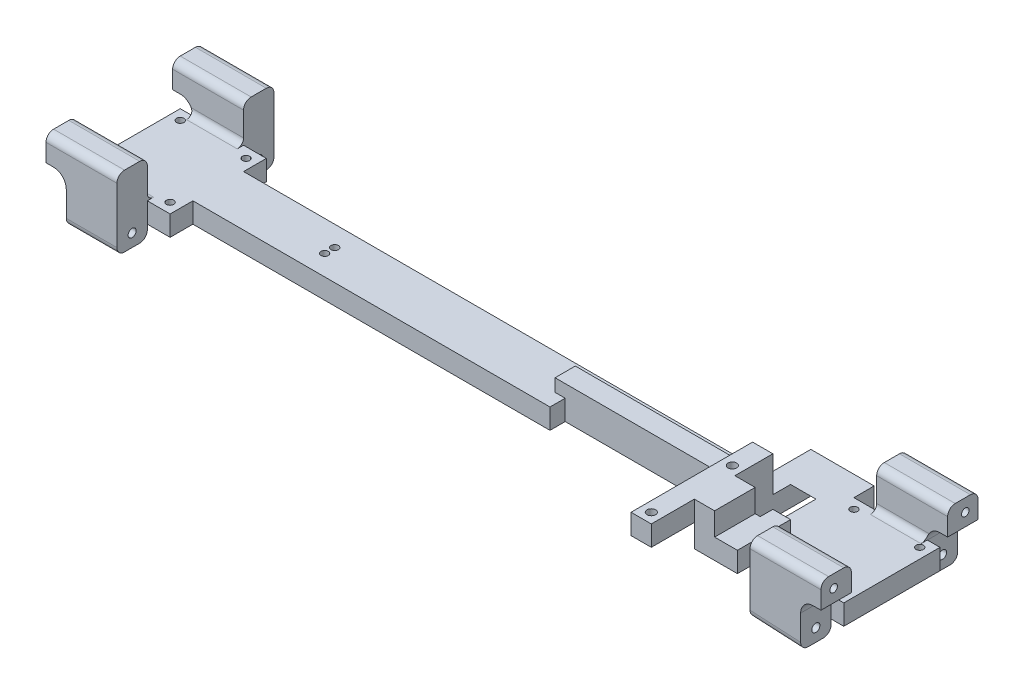
from build123d import *

# Parameters (mm, degrees)
SKETCH1_W                 = 300
SKETCH1_H                 = 20
BOSS_EXTRUDE1_DEPTH       = 8
SKETCH2_W                 = 34
SKETCH2_H                 = 8
BOSS_EXTRUDE2_DEPTH       = 9
SKETCH3_W                 = 34
SKETCH3_H                 = 8
BOSS_EXTRUDE3_DEPTH       = 9
SKETCH4_R                 = 1.45
CUT_EXTRUDE1_DEPTH        = 302.504560496
SKETCH5_W                 = 25
SKETCH5_H                 = 8
BOSS_EXTRUDE4_DEPTH       = 17
SKETCH6_W                 = 25
SKETCH6_H                 = 8
BOSS_EXTRUDE5_DEPTH       = 17
SKETCH12_W                = 8
SKETCH12_H                = 8
BOSS_EXTRUDE7_DEPTH       = 17
BOSS_EXTRUDE8_DEPTH       = 12
SKETCH15_R                = 1.6
CUT_EXTRUDE7_DEPTH        = 20
SKETCH16_W                = 20
SKETCH16_H                = 13
BOSS_EXTRUDE9_DEPTH       = 12
SKETCH17_R                = 1.6
CUT_EXTRUDE8_DEPTH        = 20
SKETCH18_W                = 20
SKETCH18_H                = 13
BOSS_EXTRUDE10_DEPTH      = 12
CUT_EXTRUDE9_START        = -20
SKETCH19_R                = 1.6
CUT_EXTRUDE9_DEPTH        = 20
SKETCH20_W                = 20
SKETCH20_H                = 13
BOSS_EXTRUDE11_DEPTH      = 12
CUT_EXTRUDE10_START       = -20
SKETCH21_R                = 1.6
CUT_EXTRUDE10_DEPTH       = 20
SKETCH22_W                = 10
SKETCH22_H                = 38
CUT_EXTRUDE11_DEPTH       = 306.0983448
SKETCH23_W                = 8
SKETCH23_H                = 18
CUT_EXTRUDE12_DEPTH       = 4
BOSS_EXTRUDE12_DEPTH      = 10
BOSS_EXTRUDE13_DEPTH      = 8
SKETCH26_W                = 8
SKETCH26_H                = 48
BOSS_EXTRUDE14_DEPTH      = 14
SKETCH27_W                = 8
SKETCH27_H                = 16
BOSS_EXTRUDE15_DEPTH      = 14
SKETCH28_W                = 8
SKETCH28_H                = 40
CUT_EXTRUDE13_DEPTH       = 14
SKETCH30_W                = 16
SKETCH30_H                = 14
BOSS_EXTRUDE16_DEPTH      = 9
SKETCH31_W                = 17
SKETCH31_H                = 8
CUT_EXTRUDE14_DEPTH       = 5
SKETCH32_W                = 16
SKETCH32_H                = 9
CUT_EXTRUDE15_DEPTH       = 9
CUT_EXTRUDE16_DEPTH       = 10
SKETCH34_W                = 7
SKETCH34_H                = 5
CUT_EXTRUDE17_DEPTH       = 5
SKETCH35_W                = 7
SKETCH35_H                = 5
BOSS_EXTRUDE17_DEPTH      = 5
SKETCH36_R                = 1.7
CUT_EXTRUDE18_DEPTH       = 307.014705529
SKETCH37_W                = 70
SKETCH37_H                = 8
BOSS_EXTRUDE18_DEPTH      = 5
SKETCH39_W                = 66
SKETCH39_H                = 6
CUT_EXTRUDE19_DEPTH       = 306.14258962
SKETCH40_W                = 20
SKETCH40_H                = 12
BOSS_EXTRUDE19_DEPTH      = 10
BOSS_EXTRUDE20_DEPTH      = 5
BOSS_EXTRUDE20_DEPTH_BACK = 5
SKETCH41_W                = 28
SKETCH41_H                = 12
SKETCH42_R                = 1.5
CUT_EXTRUDE20_DEPTH       = 15
SKETCH43_W                = 20
SKETCH43_H                = 12
BOSS_EXTRUDE21_DEPTH      = 10
BOSS_EXTRUDE22_DEPTH      = 5
BOSS_EXTRUDE22_DEPTH_BACK = 5
SKETCH44_W                = 28
SKETCH44_H                = 12
SKETCH45_R                = 1.5
CUT_EXTRUDE21_DEPTH       = 15
SKETCH46_W                = 20
SKETCH46_H                = 12
SKETCH46_W_2              = 19.974984355
BOSS_EXTRUDE23_DEPTH      = 10
BOSS_EXTRUDE24_DEPTH      = 5
BOSS_EXTRUDE24_DEPTH_BACK = 5
SKETCH47_W                = 28
SKETCH47_H                = 12
SKETCH47_W_2              = 28.025015645
CUT_EXTRUDE22_START       = -15
SKETCH48_R                = 1.5
CUT_EXTRUDE22_DEPTH       = 15
FILLET1_R                 = 5
FILLET2_R                 = 2.5
FILLET3_R                 = 3
FILLET4_R                 = 3
SKETCH49_R                = 1.45
CUT_EXTRUDE23_DEPTH       = 309.139578763


with BuildPart() as part:
    # Sketch1 → Boss-Extrude1 (new body)
    with BuildSketch(Plane(origin=(0, 0, 0), x_dir=(1, 0, 0), z_dir=(0, 1, 0))):
        with Locations((150, -10)):
            Rectangle(SKETCH1_W, SKETCH1_H)
    extrude(amount=BOSS_EXTRUDE1_DEPTH)

    # Sketch2 → Boss-Extrude2 (add)
    with BuildSketch(Plane.XY.offset(20)):
        with Locations((17, 4)):
            Rectangle(SKETCH2_W, SKETCH2_H)
        with Locations((283, 4)):
            Rectangle(SKETCH2_W, SKETCH2_H)
    extrude(amount=BOSS_EXTRUDE2_DEPTH)

    # Sketch3 → Boss-Extrude3 (add)
    with BuildSketch(Plane(origin=(0, 0, 0), x_dir=(-1, 0, 0), z_dir=(0, 0, -1))):
        with Locations((-17, 4)):
            Rectangle(SKETCH3_W, SKETCH3_H)
        with Locations((-283, 4)):
            Rectangle(SKETCH3_W, SKETCH3_H)
    extrude(amount=BOSS_EXTRUDE3_DEPTH)

    # Sketch4 → Cut-Extrude1 (cut, through all)
    with BuildSketch(Plane(origin=(0, 8, 0), x_dir=(1, 0, 0), z_dir=(0, 1, 0))):
        with Locations(Location((4, 5, 0), (0, 0, 270))):
            Circle(SKETCH4_R)
        with Locations(Location((30, 5, 0), (0, 0, 270))):
            Circle(SKETCH4_R)
        with Locations(Location((30, -25, 0), (0, 0, 270))):
            Circle(SKETCH4_R)
        with Locations(Location((4, -25, 0), (0, 0, 270))):
            Circle(SKETCH4_R)
        with Locations(Location((296, -25, 0), (0, 0, 270))):
            Circle(SKETCH4_R)
        with Locations(Location((296, 5, 0), (0, 0, 270))):
            Circle(SKETCH4_R)
        with Locations(Location((270, -25, 0), (0, 0, 270))):
            Circle(SKETCH4_R)
        with Locations(Location((270, 5, 0), (0, 0, 270))):
            Circle(SKETCH4_R)
    extrude(amount=-CUT_EXTRUDE1_DEPTH, mode=Mode.SUBTRACT)

    # Sketch5 → Boss-Extrude4 (add)
    with BuildSketch(Plane.XY.offset(20)):
        with Locations((253.5, 4)):
            Rectangle(SKETCH5_W, SKETCH5_H)
    extrude(amount=BOSS_EXTRUDE4_DEPTH)

    # Sketch6 → Boss-Extrude5 (add)
    with BuildSketch(Plane(origin=(0, 0, 0), x_dir=(-1, 0, 0), z_dir=(0, 0, -1))):
        with Locations((-253.5, 4)):
            Rectangle(SKETCH6_W, SKETCH6_H)
    extrude(amount=BOSS_EXTRUDE5_DEPTH)

    # Sketch12 → Boss-Extrude7 (add)
    with BuildSketch(Plane.XY.offset(37)):
        with Locations((245, 4)):
            Rectangle(SKETCH12_W, SKETCH12_H)
    extrude(amount=BOSS_EXTRUDE7_DEPTH)

    # Sketch14 → Boss-Extrude8 (add)
    with BuildSketch(Plane.XY.offset(29)):
        Polygon((294.974984355, 8), (275, 8), (275, -4), (294.974984355, -5), align=None)
    extrude(amount=BOSS_EXTRUDE8_DEPTH)

    # Sketch15 → Cut-Extrude7 (cut)
    with BuildSketch(Plane(origin=(294.974984355, 0, 0), x_dir=(0, 0, -1), z_dir=(1, 0, 0))):
        with Locations((-35, 0)):
            Circle(SKETCH15_R)
    extrude(amount=-CUT_EXTRUDE7_DEPTH, mode=Mode.SUBTRACT)

    # Sketch16 → Boss-Extrude9 (add)
    with BuildSketch(Plane(origin=(0, 0, -9), x_dir=(-1, 0, 0), z_dir=(0, 0, -1))):
        with Locations((-285, 1.5)):
            Rectangle(SKETCH16_W, SKETCH16_H)
    extrude(amount=BOSS_EXTRUDE9_DEPTH)

    # Sketch17 → Cut-Extrude8 (cut)
    with BuildSketch(Plane(origin=(295, 0, 0), x_dir=(0, 0, -1), z_dir=(1, 0, 0))):
        with Locations((15, 0)):
            Circle(SKETCH17_R)
    extrude(amount=-CUT_EXTRUDE8_DEPTH, mode=Mode.SUBTRACT)

    # Sketch18 → Boss-Extrude10 (add)
    with BuildSketch(Plane(origin=(0, 0, -9), x_dir=(-1, 0, 0), z_dir=(0, 0, -1))):
        with Locations((-15, 1.5)):
            Rectangle(SKETCH18_W, SKETCH18_H)
    extrude(amount=BOSS_EXTRUDE10_DEPTH)

    # Sketch19 → Cut-Extrude9 (cut)
    with BuildSketch(Plane.ZY.offset(-5).offset(CUT_EXTRUDE9_START)):
        with Locations(Location((-15, 0, 0), (0, 0, 180))):
            Circle(SKETCH19_R)
    extrude(amount=CUT_EXTRUDE9_DEPTH, mode=Mode.SUBTRACT)

    # Sketch20 → Boss-Extrude11 (add)
    with BuildSketch(Plane.XY.offset(29)):
        with Locations((15, 1.5)):
            Rectangle(SKETCH20_W, SKETCH20_H)
    extrude(amount=BOSS_EXTRUDE11_DEPTH)

    # Sketch21 → Cut-Extrude10 (cut)
    with BuildSketch(Plane.ZY.offset(-5).offset(CUT_EXTRUDE10_START)):
        with Locations(Location((35, 0, 0), (0, 0, 180))):
            Circle(SKETCH21_R)
    extrude(amount=CUT_EXTRUDE10_DEPTH, mode=Mode.SUBTRACT)

    # Sketch22 → Cut-Extrude11 (cut, through all)
    with BuildSketch(Plane(origin=(0, 8, 0), x_dir=(1, 0, 0), z_dir=(0, 1, 0))):
        with Locations((254, -10)):
            Rectangle(SKETCH22_W, SKETCH22_H)
    extrude(amount=-CUT_EXTRUDE11_DEPTH, mode=Mode.SUBTRACT)

    # Sketch23 → Cut-Extrude12 (cut)
    with BuildSketch(Plane(origin=(0, 0, 0), x_dir=(-1, 0, 0), z_dir=(0, -1, 0))):
        with Locations((-263, -10)):
            Rectangle(SKETCH23_W, SKETCH23_H)
    extrude(amount=-CUT_EXTRUDE12_DEPTH, mode=Mode.SUBTRACT)

    # Sketch24 → Boss-Extrude12 (add)
    with BuildSketch(Plane.ZY.offset(-259)):
        Polygon((-9, 0), (-9, 8), (-1, 8), align=None)
        Polygon((29, 0), (29, 8), (21, 8), align=None)
    extrude(amount=BOSS_EXTRUDE12_DEPTH)

    # Sketch25 → Boss-Extrude13 (add)
    with BuildSketch(Plane.ZY.offset(-267)):
        Polygon((19, 0), (19, 4), (15, 4), align=None)
        Polygon((1, 4), (5, 4), (1, 0), align=None)
    extrude(amount=BOSS_EXTRUDE13_DEPTH)

    # Sketch26 → Boss-Extrude14 (add)
    with BuildSketch(Plane(origin=(0, 8, 0), x_dir=(1, 0, 0), z_dir=(0, 1, 0))):
        with Locations((245, -30)):
            Rectangle(SKETCH26_W, SKETCH26_H)
    extrude(amount=BOSS_EXTRUDE14_DEPTH)

    # Sketch27 → Boss-Extrude15 (add)
    with BuildSketch(Plane(origin=(0, 8, 0), x_dir=(1, 0, 0), z_dir=(0, 1, 0))):
        with Locations((253, -29)):
            Rectangle(SKETCH27_W, SKETCH27_H)
    extrude(amount=BOSS_EXTRUDE15_DEPTH)

    # Sketch28 → Cut-Extrude13 (cut)
    with BuildSketch(Plane.XZ):
        with Locations((245, 34)):
            Rectangle(SKETCH28_W, SKETCH28_H)
    extrude(amount=-CUT_EXTRUDE13_DEPTH, mode=Mode.SUBTRACT)

    # Sketch30 → Boss-Extrude16 (add)
    with BuildSketch(Plane(origin=(257, 0, 0), x_dir=(0, 0, -1), z_dir=(1, 0, 0))):
        with Locations((-29, 15)):
            Rectangle(SKETCH30_W, SKETCH30_H)
    extrude(amount=BOSS_EXTRUDE16_DEPTH)

    # Sketch31 → Cut-Extrude14 (cut)
    with BuildSketch(Plane(origin=(0, 0, 0), x_dir=(-1, 0, 0), z_dir=(0, -1, 0))):
        with Locations((-257.5, -33)):
            Rectangle(SKETCH31_W, SKETCH31_H)
    extrude(amount=-CUT_EXTRUDE14_DEPTH, mode=Mode.SUBTRACT)

    # Sketch32 → Cut-Extrude15 (cut)
    with BuildSketch(Plane(origin=(266, 0, 0), x_dir=(0, 0, -1), z_dir=(1, 0, 0))):
        with Locations((-29, 17.5)):
            Rectangle(SKETCH32_W, SKETCH32_H)
    extrude(amount=-CUT_EXTRUDE15_DEPTH, mode=Mode.SUBTRACT)

    # Sketch33 → Cut-Extrude16 (cut)
    with BuildSketch(Plane.ZY.offset(-249)):
        Polygon((29, 5), (24, 5), (29, 0), align=None)
    extrude(amount=-CUT_EXTRUDE16_DEPTH, mode=Mode.SUBTRACT)

    # Sketch34 → Cut-Extrude17 (cut)
    with BuildSketch(Plane.XY.offset(29)):
        with Locations((262.5, 2.5)):
            Rectangle(SKETCH34_W, SKETCH34_H)
    extrude(amount=-CUT_EXTRUDE17_DEPTH, mode=Mode.SUBTRACT)

    # Sketch35 → Boss-Extrude17 (add)
    with BuildSketch(Plane(origin=(0, 0, 21), x_dir=(-1, 0, 0), z_dir=(0, 0, -1))):
        with Locations((-262.5, 10.5)):
            Rectangle(SKETCH35_W, SKETCH35_H)
    extrude(amount=BOSS_EXTRUDE17_DEPTH)

    # Sketch36 → Cut-Extrude18 (cut, through all)
    with BuildSketch(Plane(origin=(0, 22, 0), x_dir=(1, 0, 0), z_dir=(0, 1, 0))):
        with Locations(Location((245, -50, 0), (0, 0, 270))):
            Circle(SKETCH36_R)
        with Locations(Location((245, -18, 0), (0, 0, 270))):
            Circle(SKETCH36_R)
    extrude(amount=-CUT_EXTRUDE18_DEPTH, mode=Mode.SUBTRACT)

    # Sketch37 → Boss-Extrude18 (add)
    with BuildSketch(Plane(origin=(0, 8, 0), x_dir=(1, 0, 0), z_dir=(0, 1, 0))):
        with Locations((206, -10)):
            Rectangle(SKETCH37_W, SKETCH37_H)
    extrude(amount=BOSS_EXTRUDE18_DEPTH)

    # Sketch39 → Cut-Extrude19 (cut, through all)
    with BuildSketch(Plane(origin=(0, 8, 0), x_dir=(1, 0, 0), z_dir=(0, 1, 0))):
        with Locations((208, -17)):
            Rectangle(SKETCH39_W, SKETCH39_H)
    extrude(amount=-CUT_EXTRUDE19_DEPTH, mode=Mode.SUBTRACT)

    # Sketch40 → Boss-Extrude19 (add)
    with BuildSketch(Plane(origin=(0, 8, 0), x_dir=(1, 0, 0), z_dir=(0, 1, 0))):
        with Locations((15, 15)):
            Rectangle(SKETCH40_W, SKETCH40_H)
    extrude(amount=BOSS_EXTRUDE19_DEPTH)

    # Sketch41 → Boss-Extrude20 (add, two sides: drawn at the far end of the back side and taken through both)
    with BuildSketch(Plane(origin=(0, 18, 0), x_dir=(1, 0, 0), z_dir=(0, 1, 0)).offset(-BOSS_EXTRUDE20_DEPTH_BACK)):
        with Locations((11, 15)):
            Rectangle(SKETCH41_W, SKETCH41_H)
    extrude(amount=BOSS_EXTRUDE20_DEPTH + BOSS_EXTRUDE20_DEPTH_BACK)

    # Sketch42 → Cut-Extrude20 (cut)
    with BuildSketch(Plane.ZY.offset(3)):
        with Locations((-14, 18)):
            Circle(SKETCH42_R)
    extrude(amount=-CUT_EXTRUDE20_DEPTH, mode=Mode.SUBTRACT)

    # Sketch43 → Boss-Extrude21 (add)
    with BuildSketch(Plane(origin=(0, 8, 0), x_dir=(1, 0, 0), z_dir=(0, 1, 0))):
        with Locations((15, -35)):
            Rectangle(SKETCH43_W, SKETCH43_H)
    extrude(amount=BOSS_EXTRUDE21_DEPTH)

    # Sketch44 → Boss-Extrude22 (add, two sides: drawn at the far end of the back side and taken through both)
    with BuildSketch(Plane(origin=(0, 18, 0), x_dir=(1, 0, 0), z_dir=(0, 1, 0)).offset(-BOSS_EXTRUDE22_DEPTH_BACK)):
        with Locations((11, -35)):
            Rectangle(SKETCH44_W, SKETCH44_H)
    extrude(amount=BOSS_EXTRUDE22_DEPTH + BOSS_EXTRUDE22_DEPTH_BACK)

    # Sketch45 → Cut-Extrude21 (cut)
    with BuildSketch(Plane.ZY.offset(3)):
        with Locations((36, 18)):
            Circle(SKETCH45_R)
    extrude(amount=-CUT_EXTRUDE21_DEPTH, mode=Mode.SUBTRACT)

    # Sketch46 → Boss-Extrude23 (add)
    with BuildSketch(Plane(origin=(0, 8, 0), x_dir=(1, 0, 0), z_dir=(0, 1, 0))):
        with Locations((285, 15)):
            Rectangle(SKETCH46_W, SKETCH46_H)
        with Locations((284.987492178, -35)):
            Rectangle(SKETCH46_W_2, SKETCH46_H)
    extrude(amount=BOSS_EXTRUDE23_DEPTH)

    # Sketch47 → Boss-Extrude24 (add, two sides: drawn at the far end of the back side and taken through both)
    with BuildSketch(Plane(origin=(0, 18, 0), x_dir=(1, 0, 0), z_dir=(0, 1, 0)).offset(-BOSS_EXTRUDE24_DEPTH_BACK)):
        with Locations((289, 15)):
            Rectangle(SKETCH47_W, SKETCH47_H)
        with Locations((288.987492178, -35)):
            Rectangle(SKETCH47_W_2, SKETCH47_H)
    extrude(amount=BOSS_EXTRUDE24_DEPTH + BOSS_EXTRUDE24_DEPTH_BACK)

    # Sketch48 → Cut-Extrude22 (cut)
    with BuildSketch(Plane(origin=(303, 0, 0), x_dir=(0, 0, -1), z_dir=(1, 0, 0)).offset(CUT_EXTRUDE22_START)):
        with Locations((16, 18)):
            Circle(SKETCH48_R)
        with Locations(Location((-36, 18, 0), (0, 0, 180))):
            Circle(SKETCH48_R)
    extrude(amount=CUT_EXTRUDE22_DEPTH, mode=Mode.SUBTRACT)

    # Fillet1
    fillet1_edges = [part.edges().sort_by_distance(p)[0] for p in [
        (294.974984355, 13, 35),
        (295, 13, -15),
        (5, 13, 35),
        (5, 13, -15),
    ]]
    fillet(fillet1_edges, radius=FILLET1_R)

    # Fillet2
    # the kernel refuses this fillet: 2.5 mm, written as the material it adds along each edge
    with BuildSketch(Plane(origin=(-1.25, 8, -9), x_dir=(0, 1, 0), z_dir=(1, 0, 0))) as fillet2_piece_1_section:
        with BuildLine():
            CenterArc((FILLET2_R, FILLET2_R), FILLET2_R, 180, 90)
            Line((0, FILLET2_R), (0, 0))
            Line((0, 0), (FILLET2_R, 0))
        make_face()
    fillet2_piece_1 = extrude(amount=26.25, mode=Mode.PRIVATE)
    fillet2_piece_1 = fillet2_piece_1 - Plane(origin=(0, 8, -8.784630579), x_dir=(1, 0, 0), z_dir=(0, 0, -1)) * Cylinder(5, 63, mode=Mode.PRIVATE)
    add(fillet2_piece_1)
    with BuildSketch(Plane(origin=(25, 8, 29), x_dir=(0, 0, -1), z_dir=(-1, 0, 0))) as fillet2_piece_2_section:
        with BuildLine():
            CenterArc((FILLET2_R, -FILLET2_R), FILLET2_R, 90, 90)
            Line((0, -FILLET2_R), (0, 0))
            Line((0, 0), (FILLET2_R, 0))
        make_face()
    fillet2_piece_2 = extrude(amount=26.25, mode=Mode.PRIVATE)
    fillet2_piece_2 = fillet2_piece_2 - Plane(origin=(0, 8, 28.441580153), x_dir=(1, 0, 0), z_dir=(0, 0, 1)) * Cylinder(5, 63, mode=Mode.PRIVATE)
    add(fillet2_piece_2)
    with BuildSketch(Plane(origin=(301.25, 8, -9), x_dir=(0, 0, 1), z_dir=(-1, 0, 0))) as fillet2_piece_3_section:
        with BuildLine():
            CenterArc((FILLET2_R, FILLET2_R), FILLET2_R, 180, 90)
            Line((0, FILLET2_R), (0, 0))
            Line((0, 0), (FILLET2_R, 0))
        make_face()
    fillet2_piece_3 = extrude(amount=26.25, mode=Mode.PRIVATE)
    fillet2_piece_3 = fillet2_piece_3 - Plane(origin=(300, 8, -8.78460178), x_dir=(-1, 0, 0), z_dir=(0, 0, -1)) * Cylinder(5, 63, mode=Mode.PRIVATE)
    add(fillet2_piece_3)
    with BuildSketch(Plane(origin=(275, 8, 29), x_dir=(0, 0, -1), z_dir=(1, 0, 0))) as fillet2_piece_4_section:
        with BuildLine():
            CenterArc((FILLET2_R, FILLET2_R), FILLET2_R, 180, 90)
            Line((0, FILLET2_R), (0, 0))
            Line((0, 0), (FILLET2_R, 0))
        make_face()
    fillet2_piece_4 = extrude(amount=26.224984355, mode=Mode.PRIVATE)
    fillet2_piece_4 = fillet2_piece_4 - Plane(origin=(299.974984355, 8, 28.441580153), x_dir=(-1, 0, 0), z_dir=(0, 0, 1)) * Cylinder(5, 63, mode=Mode.PRIVATE)
    add(fillet2_piece_4)

    # Fillet3
    fillet3_edges = [part.edges().sort_by_distance(p)[0] for p in [
        (284.987492178, -4.5, 29),
        (284.987492178, -4.5, 41),
        (285, -5, -9),
        (285, -5, -21),
        (15, -5, -9),
        (15, -5, -21),
        (15, -5, 29),
        (15, -5, 41),
    ]]
    fillet(fillet3_edges, radius=FILLET3_R)

    # Fillet4
    fillet4_edges = [part.edges().sort_by_distance(p)[0] for p in [
        (11, 23, -21),
        (11, 23, -9),
        (11, 23, 41),
        (11, 23, 29),
        (289, 23, -9),
        (289, 23, -21),
        (288.987492178, 23, 41),
        (288.987492178, 23, 29),
    ]]
    fillet(fillet4_edges, radius=FILLET4_R)

    # Sketch49 → Cut-Extrude23 (cut, through all)
    with BuildSketch(Plane(origin=(0, 8, 0), x_dir=(1, 0, 0), z_dir=(0, 1, 0))):
        with Locations(Location((78, -8, 0), (0, 0, 270))):
            Circle(SKETCH49_R)
        with Locations(Location((78, -12, 0), (0, 0, 270))):
            Circle(SKETCH49_R)
    extrude(amount=-CUT_EXTRUDE23_DEPTH, mode=Mode.SUBTRACT)


solid = part.part
